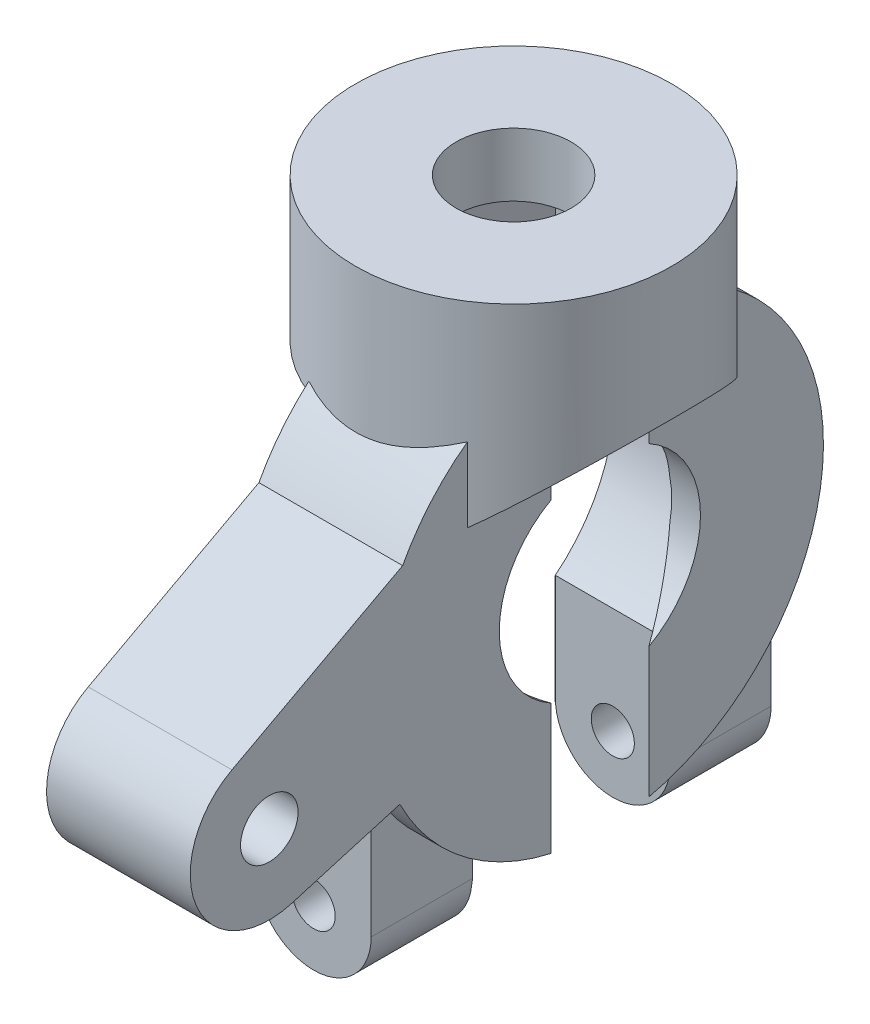
from build123d import *
from build123d.topology import SkipClean

# Parameters (mm, degrees)
SKETCH1_R               = 11
SKETCH1_R_2             = 4
BOSS_EXTRUDE1_DEPTH     = 10
SKETCH3_R               = 15.556349186
SKETCH3_R_2             = 11
BOSS_EXTRUDE2_DEPTH     = 4
CUT_EXTRUDE1_DEPTH      = 33.68393631
CUT_EXTRUDE1_DEPTH_BACK = 5.6
BOSS_EXTRUDE4_DEPTH     = 10
BOSS_EXTRUDE3_DEPTH     = 8
BOSS_EXTRUDE5_START     = 4
SKETCH3_2_R             = 15.556349186
SKETCH3_2_R_2           = 11
BOSS_EXTRUDE5_DEPTH     = 2
CUT_EXTRUDE2_DEPTH      = 37.349590584
CUT_EXTRUDE2_DEPTH_BACK = 5.6
CUT_EXTRUDE3_DEPTH      = 47.993816701
CUT_EXTRUDE3_DEPTH_BACK = 47.993816701
SKETCH13_R              = 7
CUT_EXTRUDE5_DEPTH      = 52.642447787
CUT_EXTRUDE5_DEPTH_BACK = 52.642447787
SKETCH14_R              = 1.5
SKETCH15_R              = 11.789942891
CUT_EXTRUDE6_DEPTH      = 8
BOSS_EXTRUDE6_REACH     = 48.308
SKETCH16_R              = 2


with BuildPart() as part:
    # Sketch1 → Boss-Extrude1 (new body)
    with BuildSketch(Plane(origin=(0, 0, 0), x_dir=(1, 0, 0), z_dir=(0, 1, 0))):
        with Locations(Location((0, 0, 0), (0, 0, 270))):
            Circle(SKETCH1_R)
        with Locations(Location((0, 0, 0), (0, 0, 270))):
            Circle(SKETCH1_R_2, mode=Mode.SUBTRACT)
    extrude(amount=BOSS_EXTRUDE1_DEPTH)

    # Sketch3 → Boss-Extrude2 (add, symmetric)
    with BuildSketch(Plane(origin=(0, 0, 0), x_dir=(0, 0, -1), z_dir=(1, 0, 0))):
        with Locations((0, 21)):
            Circle(SKETCH3_R)
        with Locations(Location((0, 21, 0), (0, 0, 270))):
            Circle(SKETCH3_R_2, mode=Mode.SUBTRACT)
    extrude(amount=BOSS_EXTRUDE2_DEPTH, both=True)

    # Sketch2 → Cut-Extrude1 (cut, two sides: drawn at the far end of the back side and taken through both)
    with BuildSketch(Plane(origin=(0, 10, 0), x_dir=(1, 0, 0), z_dir=(0, 1, 0)).offset(-CUT_EXTRUDE1_DEPTH_BACK)):
        Polygon((3.983716857, 6.9), (-3.983716857, 6.9), (-7.967433715, 0), (-3.983716857, -6.9), (3.983716857, -6.9), (7.967433715, 0), align=None)
    extrude(amount=CUT_EXTRUDE1_DEPTH + CUT_EXTRUDE1_DEPTH_BACK, mode=Mode.SUBTRACT)

    # Sketch9 → Boss-Extrude4 (add)
    with BuildSketch(Plane(origin=(0, 10, 0), x_dir=(1, 0, 0), z_dir=(0, 1, 0))):
        with BuildLine():
            ThreePointArc((4, -10.246950766), (11, 0), (4, 10.246950766))
            Line((4, 10.246950766), (4, 6.87179677))
            Line((4, 6.87179677), (7.967433715, 0))
            Line((7.967433715, 0), (4, -6.87179677))
            Line((4, -6.87179677), (4, -10.246950766))
        make_face()
    extrude(amount=BOSS_EXTRUDE4_DEPTH)

    # Sketch4 → Boss-Extrude3 (add)
    with BuildSketch(Plane(origin=(4, 0, 0), x_dir=(0, 0, -1), z_dir=(1, 0, 0))):
        with BuildLine():
            Line((-6.87179677, 34.956303563), (-6.87179677, 40.956303563))
            Line((-6.87179677, 40.956303563), (-13.914375327, 40.956303563))
            Line((-13.914375327, 40.956303563), (-13.914375327, 27.956303563))
            ThreePointArc((-13.914375327, 27.956303563), (-10.966596446, 32.033302425), (-6.87179677, 34.956303563))
        make_face()
        with BuildLine():
            Line((6.87179677, 34.956303563), (6.87179677, 40.956303563))
            Line((6.87179677, 40.956303563), (13.914375327, 40.956303563))
            Line((13.914375327, 40.956303563), (13.914375327, 27.956303563))
            ThreePointArc((13.914375327, 27.956303563), (10.966596446, 32.033302425), (6.87179677, 34.956303563))
        make_face()
    extrude(amount=-BOSS_EXTRUDE3_DEPTH)

    # Sketch3<2> → Boss-Extrude5 (add)
    # profile 1 of 2: a face of its own
    with SkipClean():  # the faces are left unmerged after this step: merging them gives an invalid solid
        with BuildSketch(Plane(origin=(0, 0, 0), x_dir=(0, 0, -1), z_dir=(1, 0, 0)).offset(BOSS_EXTRUDE5_START)):
            with Locations((0, 21)):
                Circle(SKETCH3_2_R)
            with Locations((0, 21)):
                Circle(SKETCH3_2_R_2, mode=Mode.SUBTRACT)
        # profile 2 of 2: a face of its own
        with BuildSketch(Plane(origin=(0, 0, 0), x_dir=(0, 0, -1), z_dir=(1, 0, 0)).offset(BOSS_EXTRUDE5_START)):
            with Locations((0, 21)):
                Circle(SKETCH3_2_R_2)
        extrude(amount=BOSS_EXTRUDE5_DEPTH)
    add(part.part.scale(1), mode=Mode.REPLACE)  # the faces are merged on a copy

    # Sketch2<2> → Cut-Extrude2 (cut, two sides: drawn at the far end of the back side and taken through both)
    with BuildSketch(Plane(origin=(0, 10, 0), x_dir=(1, 0, 0), z_dir=(0, 1, 0)).offset(-CUT_EXTRUDE2_DEPTH_BACK)):
        Polygon((3.983716857, 6.9), (-3.983716857, 6.9), (-7.967433715, 0), (-3.983716857, -6.9), (3.983716857, -6.9), (7.967433715, 0), align=None)
    extrude(amount=CUT_EXTRUDE2_DEPTH + CUT_EXTRUDE2_DEPTH_BACK, mode=Mode.SUBTRACT)

    # Sketch13 → Cut-Extrude3 (cut, two sides: drawn at the far end of the back side and taken through both)
    with BuildSketch(Plane(origin=(6, 0, 0), x_dir=(0, 0, -1), z_dir=(1, 0, 0)).offset(-CUT_EXTRUDE3_DEPTH_BACK)):
        with Locations((0, 21)):
            Circle(SKETCH13_R)
    extrude(amount=CUT_EXTRUDE3_DEPTH + CUT_EXTRUDE3_DEPTH_BACK, mode=Mode.SUBTRACT)

    # Sketch14 → Cut-Extrude5 (cut, two sides: drawn at the far end of the back side and taken through both)
    with BuildSketch(Plane.XY.offset(13.914375327).offset(-CUT_EXTRUDE5_DEPTH_BACK)):
        with Locations((0, 36.956303563)):
            Circle(SKETCH14_R)
        with BuildLine():
            Line((-4, 36.956303563), (-4, 43.473651887))
            Line((-4, 43.473651887), (4, 43.473651887))
            Line((4, 43.473651887), (4, 36.956303563))
            ThreePointArc((4, 36.956303563), (0, 40.956303563), (-4, 36.956303563))
        make_face()
    extrude(amount=CUT_EXTRUDE5_DEPTH + CUT_EXTRUDE5_DEPTH_BACK, mode=Mode.SUBTRACT)

    # Sketch15 → Cut-Extrude6 (cut)
    with BuildSketch(Plane(origin=(6, 0, 0), x_dir=(0, 0, -1), z_dir=(1, 0, 0))):
        with Locations((0, 21)):
            Circle(SKETCH15_R)
    extrude(amount=CUT_EXTRUDE6_DEPTH, mode=Mode.SUBTRACT)

    # Boss-Extrude6: up to this face of the body (flat: up to its plane)
    boss_extrude6_end = Plane(part.part.faces().sort_by_distance((6, 22.369931635, 9.227258585))[0])
    # Sketch16 → Boss-Extrude6 (add, up to the picked face)
    with BuildSketch(Plane.ZY.offset(4), mode=Mode.PRIVATE) as boss_extrude6_sk1:
        with BuildLine():
            Line((13.723567505, 13.674449171), (25.599337953, 20.043155389))
            ThreePointArc((25.599337953, 20.043155389), (28.089469493, 26.975176866), (21.451586712, 30.167697662))
            Line((21.451586712, 30.167697662), (13.914375327, 27.956303563))
            ThreePointArc((13.914375327, 27.956303563), (15.554961016, 20.792183273), (13.723567505, 13.674449171))
        make_face()
        with Locations((23, 24.890158814)):
            Circle(SKETCH16_R, mode=Mode.SUBTRACT)
    boss_extrude6_tool1 = split(extrude(boss_extrude6_sk1.sketch, amount=-BOSS_EXTRUDE6_REACH, mode=Mode.PRIVATE), bisect_by=boss_extrude6_end, keep=Keep.BOTH, mode=Mode.PRIVATE)
    add(boss_extrude6_tool1.solids().sort_by(Axis((-4, 23.412763, 20.74002), (1, 0, 0)))[0])


with BuildPart() as body_2:
    # Mirror1: mirrored copy
    add(part.part.mirror(Plane(origin=(0, -20, 0), x_dir=(0, 0, 1), z_dir=(0, -1, 0))))


solid = body_2.part
